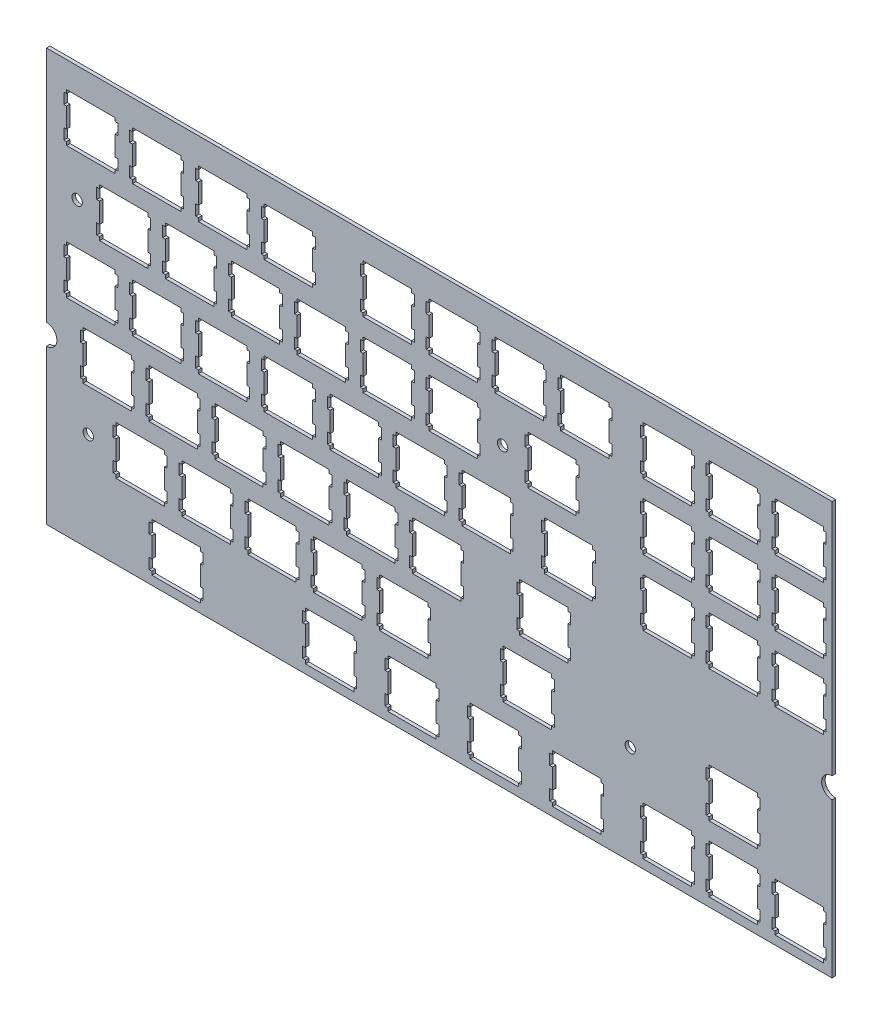
from build123d import *

# Parameters (mm, degrees)
MODEL_R         = 1.5
EXTRUDE_1_DEPTH = 1


with BuildPart() as part:
    # Model → 凸台-拉伸1 (new body)
    with BuildSketch(Plane.XY):
        with BuildLine():
            Line((423.20103802, 126.210093993), (423.20103802, 194.884693993))
            Line((423.20103802, 194.884693993), (196.08703802, 194.884693993))
            Line((196.08703802, 194.884693993), (196.08703802, 126.210093993))
            ThreePointArc((196.08703802, 126.210093993), (199.08703802, 123.210093993), (196.08703802, 120.210093993))
            Line((196.08703802, 120.210093993), (196.08703802, 75.584386993))
            Line((196.08703802, 75.584386993), (423.20103802, 75.584386993))
            Line((423.20103802, 75.584386993), (423.20103802, 120.210093993))
            ThreePointArc((423.20103802, 120.210093993), (420.20103802, 123.210093993), (423.20103802, 126.210093993))
        make_face()
        Polygon((226.56101302, 82.210013993), (226.56101302, 88.011523993), (225.76181302, 88.011523993), (225.76181302, 91.110823993), (226.56101302, 91.110823993), (226.56101302, 92.111223993), (240.56181302, 92.111223993), (240.56181302, 91.110823993), (241.36121302, 91.110823993), (241.36121302, 88.011523993), (240.56181302, 88.011523993), (240.56181302, 82.210013993), (241.36121302, 82.210013993), (241.36121302, 79.110833993), (240.56181302, 79.110833993), (240.56181302, 78.110363993), (226.56101302, 78.110363993), (226.56101302, 79.110833993), (225.76181302, 79.110833993), (225.76181302, 82.210013993), align=None, mode=Mode.SUBTRACT)
        with Locations((208.17503802, 104.160393993)):
            Circle(MODEL_R, mode=Mode.SUBTRACT)
        Polygon((216.17503802, 110.159393993), (216.17503802, 111.159693993), (223.17503802, 111.159693993), (230.17503802, 111.159693993), (230.17503802, 110.159393993), (230.97403802, 110.159393993), (230.97403802, 107.061493993), (230.17503802, 107.061493993), (230.17503802, 101.259993993), (230.97403802, 101.259993993), (230.97403802, 98.159393993), (230.17503802, 98.159393993), (230.17503802, 97.160293993), (216.17503802, 97.160293993), (216.17503802, 98.159393993), (215.37403802, 98.159393993), (215.37403802, 101.259993993), (216.17503802, 101.259993993), (216.17503802, 107.061493993), (215.37403802, 107.061493993), (215.37403802, 110.159393993), align=None, mode=Mode.SUBTRACT)
        Polygon((235.22503802, 110.159393993), (235.22503802, 111.159693993), (242.22503802, 111.159693993), (249.22503802, 111.159693993), (249.22503802, 110.159393993), (250.02403802, 110.159393993), (250.02403802, 107.061493993), (249.22503802, 107.061493993), (249.22503802, 101.259993993), (250.02403802, 101.259993993), (250.02403802, 98.159393993), (249.22503802, 98.159393993), (249.22503802, 97.160293993), (235.22503802, 97.160293993), (235.22503802, 98.159393993), (234.42403802, 98.159393993), (234.42403802, 101.259993993), (235.22503802, 101.259993993), (235.22503802, 107.061493993), (234.42403802, 107.061493993), (234.42403802, 110.159393993), align=None, mode=Mode.SUBTRACT)
        Polygon((270.94403802, 91.110793993), (270.94403802, 92.111193993), (277.94353802, 92.111193993), (284.94303802, 92.111193993), (284.94303802, 91.110793993), (285.74403802, 91.110793993), (285.74403802, 88.011493993), (284.94303802, 88.011493993), (284.94303802, 85.111493993), (284.94303802, 82.209983993), (285.74403802, 82.209983993), (285.74403802, 79.110803993), (284.94303802, 79.110803993), (284.94303802, 78.110333993), (270.94403802, 78.110333993), (270.94403802, 79.110803993), (270.14303802, 79.110803993), (270.14303802, 82.209983993), (270.94403802, 82.209983993), (270.94403802, 85.111493993), (270.94403802, 88.011493993), (270.14303802, 88.011493993), (270.14303802, 91.110793993), align=None, mode=Mode.SUBTRACT)
        Polygon((294.75503802, 91.110793993), (294.75503802, 92.111193993), (301.75553802, 92.111193993), (308.75603802, 92.111193993), (308.75603802, 91.110793993), (309.55503802, 91.110793993), (309.55503802, 88.011493993), (308.75603802, 88.011493993), (308.75603802, 82.209983993), (309.55503802, 82.209983993), (309.55503802, 79.110803993), (308.75603802, 79.110803993), (308.75603802, 78.110333993), (294.75503802, 78.110333993), (294.75503802, 79.110803993), (293.95603802, 79.110803993), (293.95603802, 82.209983993), (294.75503802, 82.209983993), (294.75503802, 88.011493993), (293.95603802, 88.011493993), (293.95603802, 91.110793993), align=None, mode=Mode.SUBTRACT)
        Polygon((254.27503802, 110.159393993), (254.27503802, 111.159693993), (261.27503802, 111.159693993), (268.27503802, 111.159693993), (268.27503802, 110.159393993), (269.07403802, 110.159393993), (269.07403802, 107.061493993), (268.27503802, 107.061493993), (268.27503802, 101.259993993), (269.07403802, 101.259993993), (269.07403802, 98.159393993), (268.27503802, 98.159393993), (268.27503802, 97.160293993), (254.27503802, 97.160293993), (254.27503802, 98.159393993), (253.47403802, 98.159393993), (253.47403802, 101.259993993), (254.27503802, 101.259993993), (254.27503802, 107.061493993), (253.47403802, 107.061493993), (253.47403802, 110.159393993), align=None, mode=Mode.SUBTRACT)
        Polygon((273.32503802, 110.159393993), (273.32503802, 111.159693993), (280.32503802, 111.159693993), (287.32503802, 111.159693993), (287.32503802, 110.159393993), (288.12403802, 110.159393993), (288.12403802, 107.061493993), (287.32503802, 107.061493993), (287.32503802, 101.259993993), (288.12403802, 101.259993993), (288.12403802, 98.159393993), (287.32503802, 98.159393993), (287.32503802, 97.160293993), (273.32503802, 97.160293993), (273.32503802, 98.159393993), (272.52403802, 98.159393993), (272.52403802, 101.259993993), (273.32503802, 101.259993993), (273.32503802, 107.061493993), (272.52403802, 107.061493993), (272.52403802, 110.159393993), align=None, mode=Mode.SUBTRACT)
        Polygon((292.37503802, 110.159393993), (292.37503802, 111.159693993), (299.37503802, 111.159693993), (306.37503802, 111.159693993), (306.37503802, 110.159393993), (307.17403802, 110.159393993), (307.17403802, 107.061493993), (306.37503802, 107.061493993), (306.37503802, 101.259993993), (307.17403802, 101.259993993), (307.17403802, 98.159393993), (306.37503802, 98.159393993), (306.37503802, 97.160293993), (292.37503802, 97.160293993), (292.37503802, 98.159393993), (291.57403802, 98.159393993), (291.57403802, 101.259993993), (292.37503802, 101.259993993), (292.37503802, 107.061493993), (291.57403802, 107.061493993), (291.57403802, 110.159393993), align=None, mode=Mode.SUBTRACT)
        Polygon((206.65003802, 129.209293993), (206.65003802, 130.209793993), (213.65003802, 130.209793993), (220.65003802, 130.209793993), (220.65003802, 129.209293993), (221.44903802, 129.209293993), (221.44903802, 126.111493993), (220.65003802, 126.111493993), (220.65003802, 120.310093993), (221.44903802, 120.310093993), (221.44903802, 117.209493993), (220.65003802, 117.209493993), (220.65003802, 116.210493993), (206.65003802, 116.210493993), (206.65003802, 117.209493993), (205.84903802, 117.209493993), (205.84903802, 120.310093993), (206.65003802, 120.310093993), (206.65003802, 126.111493993), (205.84903802, 126.111493993), (205.84903802, 129.209293993), align=None, mode=Mode.SUBTRACT)
        Polygon((225.70003802, 129.209293993), (225.70003802, 130.209793993), (232.70003802, 130.209793993), (239.70003802, 130.209793993), (239.70003802, 129.209293993), (240.49903802, 129.209293993), (240.49903802, 126.111493993), (239.70003802, 126.111493993), (239.70003802, 120.310093993), (240.49903802, 120.310093993), (240.49903802, 117.209493993), (239.70003802, 117.209493993), (239.70003802, 116.210493993), (225.70003802, 116.210493993), (225.70003802, 117.209493993), (224.89903802, 117.209493993), (224.89903802, 120.310093993), (225.70003802, 120.310093993), (225.70003802, 126.111493993), (224.89903802, 126.111493993), (224.89903802, 129.209293993), align=None, mode=Mode.SUBTRACT)
        Polygon((244.75003802, 129.209293993), (244.75003802, 130.209793993), (251.75003802, 130.209793993), (258.75003802, 130.209793993), (258.75003802, 129.209293993), (259.54903802, 129.209293993), (259.54903802, 126.111493993), (258.75003802, 126.111493993), (258.75003802, 120.310093993), (259.54903802, 120.310093993), (259.54903802, 117.209493993), (258.75003802, 117.209493993), (258.75003802, 116.210493993), (244.75003802, 116.210493993), (244.75003802, 117.209493993), (243.94903802, 117.209493993), (243.94903802, 120.310093993), (244.75003802, 120.310093993), (244.75003802, 126.111493993), (243.94903802, 126.111493993), (243.94903802, 129.209293993), align=None, mode=Mode.SUBTRACT)
        Polygon((263.80003802, 129.209293993), (263.80003802, 130.209793993), (270.80003802, 130.209793993), (277.80003802, 130.209793993), (277.80003802, 129.209293993), (278.59903802, 129.209293993), (278.59903802, 126.111493993), (277.80003802, 126.111493993), (277.80003802, 120.310093993), (278.59903802, 120.310093993), (278.59903802, 117.209493993), (277.80003802, 117.209493993), (277.80003802, 116.210493993), (263.80003802, 116.210493993), (263.80003802, 117.209493993), (262.99903802, 117.209493993), (262.99903802, 120.310093993), (263.80003802, 120.310093993), (263.80003802, 126.111493993), (262.99903802, 126.111493993), (262.99903802, 129.209293993), align=None, mode=Mode.SUBTRACT)
        Polygon((282.85003802, 129.209293993), (282.85003802, 130.209793993), (289.85003802, 130.209793993), (296.85003802, 130.209793993), (296.85003802, 129.209293993), (297.64903802, 129.209293993), (297.64903802, 126.111493993), (296.85003802, 126.111493993), (296.85003802, 120.310093993), (297.64903802, 120.310093993), (297.64903802, 117.209493993), (296.85003802, 117.209493993), (296.85003802, 116.210493993), (282.85003802, 116.210493993), (282.85003802, 117.209493993), (282.04903802, 117.209493993), (282.04903802, 120.310093993), (282.85003802, 120.310093993), (282.85003802, 126.111493993), (282.04903802, 126.111493993), (282.04903802, 129.209293993), align=None, mode=Mode.SUBTRACT)
        Polygon((318.56903802, 91.110793993), (318.56903802, 92.111193993), (325.56853802, 92.111193993), (332.56803802, 92.111193993), (332.56803802, 91.110793993), (333.36903802, 91.110793993), (333.36903802, 88.011493993), (332.56803802, 88.011493993), (332.56803802, 85.111493993), (332.56803802, 82.209983993), (333.36903802, 82.209983993), (333.36903802, 79.110803993), (332.56803802, 79.110803993), (332.56803802, 78.110333993), (318.56903802, 78.110333993), (318.56903802, 79.110803993), (317.76803802, 79.110803993), (317.76803802, 82.209983993), (318.56903802, 82.209983993), (318.56903802, 85.111493993), (318.56903802, 88.011493993), (317.76803802, 88.011493993), (317.76803802, 91.110793993), align=None, mode=Mode.SUBTRACT)
        Polygon((342.38003802, 91.110793993), (342.38003802, 92.111193993), (349.38053802, 92.111193993), (356.38103802, 92.111193993), (356.38103802, 91.110793993), (357.18003802, 91.110793993), (357.18003802, 88.011493993), (356.38103802, 88.011493993), (356.38103802, 82.209983993), (357.18003802, 82.209983993), (357.18003802, 79.110803993), (356.38103802, 79.110803993), (356.38103802, 78.110333993), (342.38003802, 78.110333993), (342.38003802, 79.110803993), (341.58103802, 79.110803993), (341.58103802, 82.209983993), (342.38003802, 82.209983993), (342.38003802, 88.011493993), (341.58103802, 88.011493993), (341.58103802, 91.110793993), align=None, mode=Mode.SUBTRACT)
        Polygon((328.09201302, 110.160048993), (328.09201302, 111.160448993), (342.09281302, 111.160448993), (342.09281302, 110.160048993), (342.89221302, 110.160048993), (342.89221302, 107.060748993), (342.09281302, 107.060748993), (342.09281302, 101.259238993), (342.89221302, 101.259238993), (342.89221302, 98.160058993), (342.09281302, 98.160058993), (342.09281302, 97.159588993), (328.09201302, 97.159588993), (328.09201302, 98.160058993), (327.29281302, 98.160058993), (327.29281302, 101.259238993), (328.09201302, 101.259238993), (328.09201302, 107.060748993), (327.29281302, 107.060748993), (327.29281302, 110.160048993), align=None, mode=Mode.SUBTRACT)
        with Locations((364.85892552, 104.160368993)):
            Circle(MODEL_R, mode=Mode.SUBTRACT)
        Polygon((368.57503802, 91.110793993), (368.57503802, 92.111193993), (375.57503802, 92.111193993), (382.57503802, 92.111193993), (382.57503802, 91.110793993), (383.37403802, 91.110793993), (383.37403802, 88.011493993), (382.57503802, 88.011493993), (382.57503802, 82.209983993), (383.37403802, 82.209983993), (383.37403802, 79.110803993), (382.57503802, 79.110803993), (382.57503802, 78.110333993), (368.57503802, 78.110333993), (368.57503802, 79.110803993), (367.77403802, 79.110803993), (367.77403802, 82.209983993), (368.57503802, 82.209983993), (368.57503802, 88.011493993), (367.77403802, 88.011493993), (367.77403802, 91.110793993), align=None, mode=Mode.SUBTRACT)
        Polygon((387.62503802, 91.110793993), (387.62503802, 92.111193993), (394.62503802, 92.111193993), (401.62503802, 92.111193993), (401.62503802, 91.110793993), (402.42403802, 91.110793993), (402.42403802, 88.011493993), (401.62503802, 88.011493993), (401.62503802, 82.209983993), (402.42403802, 82.209983993), (402.42403802, 79.110803993), (401.62503802, 79.110803993), (401.62503802, 78.110333993), (387.62503802, 78.110333993), (387.62503802, 79.110803993), (386.82403802, 79.110803993), (386.82403802, 82.209983993), (387.62503802, 82.209983993), (387.62503802, 88.011493993), (386.82403802, 88.011493993), (386.82403802, 91.110793993), align=None, mode=Mode.SUBTRACT)
        Polygon((406.67503802, 91.110793993), (406.67503802, 92.111193993), (413.67503802, 92.111193993), (420.67503802, 92.111193993), (420.67503802, 91.110793993), (421.47403802, 91.110793993), (421.47403802, 88.011493993), (420.67503802, 88.011493993), (420.67503802, 82.209983993), (421.47403802, 82.209983993), (421.47403802, 79.110803993), (420.67503802, 79.110803993), (420.67503802, 78.110333993), (406.67503802, 78.110333993), (406.67503802, 79.110803993), (405.87403802, 79.110803993), (405.87403802, 82.209983993), (406.67503802, 82.209983993), (406.67503802, 88.011493993), (405.87403802, 88.011493993), (405.87403802, 91.110793993), align=None, mode=Mode.SUBTRACT)
        Polygon((387.62503802, 110.159393993), (387.62503802, 111.159693993), (394.62503802, 111.159693993), (401.62503802, 111.159693993), (401.62503802, 110.159393993), (402.42403802, 110.159393993), (402.42403802, 107.061493993), (401.62503802, 107.061493993), (401.62503802, 101.259993993), (402.42403802, 101.259993993), (402.42403802, 98.159393993), (401.62503802, 98.159393993), (401.62503802, 97.160293993), (387.62503802, 97.160293993), (387.62503802, 98.159393993), (386.82403802, 98.159393993), (386.82403802, 101.259993993), (387.62503802, 101.259993993), (387.62503802, 107.061493993), (386.82403802, 107.061493993), (386.82403802, 110.159393993), align=None, mode=Mode.SUBTRACT)
        Polygon((301.90003802, 129.209293993), (301.90003802, 130.209793993), (308.90003802, 130.209793993), (315.90003802, 130.209793993), (315.90003802, 129.209293993), (316.69903802, 129.209293993), (316.69903802, 126.111493993), (315.90003802, 126.111493993), (315.90003802, 120.310093993), (316.69903802, 120.310093993), (316.69903802, 117.209493993), (315.90003802, 117.209493993), (315.90003802, 116.210493993), (301.90003802, 116.210493993), (301.90003802, 117.209493993), (301.09903802, 117.209493993), (301.09903802, 120.310093993), (301.90003802, 120.310093993), (301.90003802, 126.111493993), (301.09903802, 126.111493993), (301.09903802, 129.209293993), align=None, mode=Mode.SUBTRACT)
        Polygon((332.85503802, 129.209293993), (332.85503802, 130.209793993), (339.85553802, 130.209793993), (346.85603802, 130.209793993), (346.85603802, 129.209293993), (347.65503802, 129.209293993), (347.65503802, 126.111493993), (346.85603802, 126.111493993), (346.85603802, 120.310093993), (347.65503802, 120.310093993), (347.65503802, 117.209493993), (346.85603802, 117.209493993), (346.85603802, 116.210493993), (332.85503802, 116.210493993), (332.85503802, 117.209493993), (332.05403802, 117.209493993), (332.05403802, 120.310093993), (332.85503802, 120.310093993), (332.85503802, 126.111493993), (332.05403802, 126.111493993), (332.05403802, 129.209293993), align=None, mode=Mode.SUBTRACT)
        Polygon((215.88703802, 135.260493993), (201.88803802, 135.260493993), (201.88803802, 136.259493993), (201.08703802, 136.259493993), (201.08703802, 139.360093993), (201.88803802, 139.360093993), (201.88803802, 142.260093993), (201.88803802, 145.160093993), (201.08703802, 145.160093993), (201.08703802, 148.259293993), (201.88803802, 148.259293993), (201.88803802, 149.259793993), (208.88753802, 149.259793993), (215.88703802, 149.259793993), (215.88703802, 148.259293993), (216.68803802, 148.259293993), (216.68803802, 145.160093993), (215.88703802, 145.160093993), (215.88703802, 142.260093993), (215.88703802, 139.360093993), (216.68803802, 139.360093993), (216.68803802, 136.259493993), (215.88703802, 136.259493993), align=None, mode=Mode.SUBTRACT)
        Polygon((220.93803802, 148.259293993), (220.93803802, 149.259793993), (227.93753802, 149.259793993), (234.93703802, 149.259793993), (234.93703802, 148.259293993), (235.73803802, 148.259293993), (235.73803802, 145.160093993), (234.93703802, 145.160093993), (234.93703802, 142.260093993), (234.93703802, 139.360093993), (235.73803802, 139.360093993), (235.73803802, 136.259493993), (234.93703802, 136.259493993), (234.93703802, 135.260493993), (220.93803802, 135.260493993), (220.93803802, 136.259493993), (220.13703802, 136.259493993), (220.13703802, 139.360093993), (220.93803802, 139.360093993), (220.93803802, 142.260093993), (220.93803802, 145.160093993), (220.13703802, 145.160093993), (220.13703802, 148.259293993), align=None, mode=Mode.SUBTRACT)
        Polygon((239.98803802, 148.259293993), (239.98803802, 149.259793993), (246.98753802, 149.259793993), (253.98703802, 149.259793993), (253.98703802, 148.259293993), (254.78803802, 148.259293993), (254.78803802, 145.160093993), (253.98703802, 145.160093993), (253.98703802, 142.260093993), (253.98703802, 139.360093993), (254.78803802, 139.360093993), (254.78803802, 136.259493993), (253.98703802, 136.259493993), (253.98703802, 135.260493993), (239.98803802, 135.260493993), (239.98803802, 136.259493993), (239.18703802, 136.259493993), (239.18703802, 139.360093993), (239.98803802, 139.360093993), (239.98803802, 142.260093993), (239.98803802, 145.160093993), (239.18703802, 145.160093993), (239.18703802, 148.259293993), align=None, mode=Mode.SUBTRACT)
        with Locations((204.94992552, 161.310093993)):
            Circle(MODEL_R, mode=Mode.SUBTRACT)
        Polygon((211.41303802, 167.309293993), (211.41303802, 168.309793993), (218.41253802, 168.309793993), (225.41203802, 168.309793993), (225.41203802, 167.309293993), (226.21303802, 167.309293993), (226.21303802, 164.210093993), (225.41203802, 164.210093993), (225.41203802, 161.310093993), (225.41203802, 158.410093993), (226.21303802, 158.410093993), (226.21303802, 155.309493993), (225.41203802, 155.309493993), (225.41203802, 154.310493993), (211.41303802, 154.310493993), (211.41303802, 155.309493993), (210.61203802, 155.309493993), (210.61203802, 158.410093993), (211.41303802, 158.410093993), (211.41303802, 161.310093993), (211.41303802, 164.210093993), (210.61203802, 164.210093993), (210.61203802, 167.309293993), align=None, mode=Mode.SUBTRACT)
        Polygon((230.46303802, 167.309293993), (230.46303802, 168.309793993), (237.46253802, 168.309793993), (244.46203802, 168.309793993), (244.46203802, 167.309293993), (245.26303802, 167.309293993), (245.26303802, 164.210093993), (244.46203802, 164.210093993), (244.46203802, 161.310093993), (244.46203802, 158.410093993), (245.26303802, 158.410093993), (245.26303802, 155.309493993), (244.46203802, 155.309493993), (244.46203802, 154.310493993), (230.46303802, 154.310493993), (230.46303802, 155.309493993), (229.66203802, 155.309493993), (229.66203802, 158.410093993), (230.46303802, 158.410093993), (230.46303802, 161.310093993), (230.46303802, 164.210093993), (229.66203802, 164.210093993), (229.66203802, 167.309293993), align=None, mode=Mode.SUBTRACT)
        Polygon((259.03803802, 148.259293993), (259.03803802, 149.259793993), (266.03753802, 149.259793993), (273.03703802, 149.259793993), (273.03703802, 148.259293993), (273.83803802, 148.259293993), (273.83803802, 145.160093993), (273.03703802, 145.160093993), (273.03703802, 142.260093993), (273.03703802, 139.360093993), (273.83803802, 139.360093993), (273.83803802, 136.259493993), (273.03703802, 136.259493993), (273.03703802, 135.260493993), (259.03803802, 135.260493993), (259.03803802, 136.259493993), (258.23703802, 136.259493993), (258.23703802, 139.360093993), (259.03803802, 139.360093993), (259.03803802, 142.260093993), (259.03803802, 145.160093993), (258.23703802, 145.160093993), (258.23703802, 148.259293993), align=None, mode=Mode.SUBTRACT)
        Polygon((278.08803802, 148.259293993), (278.08803802, 149.259793993), (285.08753802, 149.259793993), (292.08703802, 149.259793993), (292.08703802, 148.259293993), (292.88803802, 148.259293993), (292.88803802, 145.160093993), (292.08703802, 145.160093993), (292.08703802, 142.260093993), (292.08703802, 139.360093993), (292.88803802, 139.360093993), (292.88803802, 136.259493993), (292.08703802, 136.259493993), (292.08703802, 135.260493993), (278.08803802, 135.260493993), (278.08803802, 136.259493993), (277.28703802, 136.259493993), (277.28703802, 139.360093993), (278.08803802, 139.360093993), (278.08803802, 142.260093993), (278.08803802, 145.160093993), (277.28703802, 145.160093993), (277.28703802, 148.259293993), align=None, mode=Mode.SUBTRACT)
        Polygon((297.13803802, 148.259293993), (297.13803802, 149.259793993), (304.13753802, 149.259793993), (311.13703802, 149.259793993), (311.13703802, 148.259293993), (311.93803802, 148.259293993), (311.93803802, 145.160093993), (311.13703802, 145.160093993), (311.13703802, 142.260093993), (311.13703802, 139.360093993), (311.93803802, 139.360093993), (311.93803802, 136.259493993), (311.13703802, 136.259493993), (311.13703802, 135.260493993), (297.13803802, 135.260493993), (297.13803802, 136.259493993), (296.33703802, 136.259493993), (296.33703802, 139.360093993), (297.13803802, 139.360093993), (297.13803802, 142.260093993), (297.13803802, 145.160093993), (296.33703802, 145.160093993), (296.33703802, 148.259293993), align=None, mode=Mode.SUBTRACT)
        Polygon((249.51303802, 167.309293993), (249.51303802, 168.309793993), (256.51253802, 168.309793993), (263.51203802, 168.309793993), (263.51203802, 167.309293993), (264.31303802, 167.309293993), (264.31303802, 164.210093993), (263.51203802, 164.210093993), (263.51203802, 161.310093993), (263.51203802, 158.410093993), (264.31303802, 158.410093993), (264.31303802, 155.309493993), (263.51203802, 155.309493993), (263.51203802, 154.310493993), (249.51303802, 154.310493993), (249.51303802, 155.309493993), (248.71203802, 155.309493993), (248.71203802, 158.410093993), (249.51303802, 158.410093993), (249.51303802, 161.310093993), (249.51303802, 164.210093993), (248.71203802, 164.210093993), (248.71203802, 167.309293993), align=None, mode=Mode.SUBTRACT)
        Polygon((268.56303802, 167.309293993), (268.56303802, 168.309793993), (275.56253802, 168.309793993), (282.56203802, 168.309793993), (282.56203802, 167.309293993), (283.36303802, 167.309293993), (283.36303802, 164.210093993), (282.56203802, 164.210093993), (282.56203802, 161.310093993), (282.56203802, 158.410093993), (283.36303802, 158.410093993), (283.36303802, 155.309493993), (282.56203802, 155.309493993), (282.56203802, 154.310493993), (268.56303802, 154.310493993), (268.56303802, 155.309493993), (267.76203802, 155.309493993), (267.76203802, 158.410093993), (268.56303802, 158.410093993), (268.56303802, 161.310093993), (268.56303802, 164.210093993), (267.76203802, 164.210093993), (267.76203802, 167.309293993), align=None, mode=Mode.SUBTRACT)
        Polygon((287.61303802, 167.309293993), (287.61303802, 168.309793993), (294.61253802, 168.309793993), (301.61203802, 168.309793993), (301.61203802, 167.309293993), (302.41303802, 167.309293993), (302.41303802, 164.210093993), (301.61203802, 164.210093993), (301.61203802, 161.310093993), (301.61203802, 158.410093993), (302.41303802, 158.410093993), (302.41303802, 155.309493993), (301.61203802, 155.309493993), (301.61203802, 154.310493993), (287.61303802, 154.310493993), (287.61303802, 155.309493993), (286.81203802, 155.309493993), (286.81203802, 158.410093993), (287.61303802, 158.410093993), (287.61303802, 161.310093993), (287.61303802, 164.210093993), (286.81203802, 164.210093993), (286.81203802, 167.309293993), align=None, mode=Mode.SUBTRACT)
        Polygon((215.88703802, 173.360493993), (201.88803802, 173.360493993), (201.88803802, 174.359493993), (201.08703802, 174.359493993), (201.08703802, 177.459693993), (201.88803802, 177.459693993), (201.88803802, 180.359993993), (201.88803802, 183.259693993), (201.08703802, 183.259693993), (201.08703802, 186.359693993), (201.88803802, 186.359693993), (201.88803802, 187.359693993), (215.88703802, 187.359693993), (215.88703802, 186.359693993), (216.68803802, 186.359693993), (216.68803802, 183.259693993), (215.88703802, 183.259693993), (215.88703802, 180.359993993), (215.88703802, 177.459693993), (216.68803802, 177.459693993), (216.68803802, 174.359493993), (215.88703802, 174.359493993), align=None, mode=Mode.SUBTRACT)
        Polygon((220.93803802, 186.359693993), (220.93803802, 187.359693993), (227.93753802, 187.359693993), (234.93703802, 187.359693993), (234.93703802, 186.359693993), (235.73803802, 186.359693993), (235.73803802, 183.259693993), (234.93703802, 183.259693993), (234.93703802, 180.359993993), (234.93703802, 177.459693993), (235.73803802, 177.459693993), (235.73803802, 174.359493993), (234.93703802, 174.359493993), (234.93703802, 173.360493993), (220.93803802, 173.360493993), (220.93803802, 174.359493993), (220.13703802, 174.359493993), (220.13703802, 177.459693993), (220.93803802, 177.459693993), (220.93803802, 180.359993993), (220.93803802, 183.259693993), (220.13703802, 183.259693993), (220.13703802, 186.359693993), align=None, mode=Mode.SUBTRACT)
        Polygon((239.98803802, 186.359693993), (239.98803802, 187.359693993), (246.98753802, 187.359693993), (253.98703802, 187.359693993), (253.98703802, 186.359693993), (254.78803802, 186.359693993), (254.78803802, 183.259693993), (253.98703802, 183.259693993), (253.98703802, 180.359993993), (253.98703802, 177.459693993), (254.78803802, 177.459693993), (254.78803802, 174.359493993), (253.98703802, 174.359493993), (253.98703802, 173.360493993), (239.98803802, 173.360493993), (239.98803802, 174.359493993), (239.18703802, 174.359493993), (239.18703802, 177.459693993), (239.98803802, 177.459693993), (239.98803802, 180.359993993), (239.98803802, 183.259693993), (239.18703802, 183.259693993), (239.18703802, 186.359693993), align=None, mode=Mode.SUBTRACT)
        Polygon((259.03803802, 186.359693993), (259.03803802, 187.359693993), (266.03753802, 187.359693993), (273.03703802, 187.359693993), (273.03703802, 186.359693993), (273.83803802, 186.359693993), (273.83803802, 183.259693993), (273.03703802, 183.259693993), (273.03703802, 180.359993993), (273.03703802, 177.459693993), (273.83803802, 177.459693993), (273.83803802, 174.359493993), (273.03703802, 174.359493993), (273.03703802, 173.360493993), (259.03803802, 173.360493993), (259.03803802, 174.359493993), (258.23703802, 174.359493993), (258.23703802, 177.459693993), (259.03803802, 177.459693993), (259.03803802, 180.359993993), (259.03803802, 183.259693993), (258.23703802, 183.259693993), (258.23703802, 186.359693993), align=None, mode=Mode.SUBTRACT)
        Polygon((287.61303802, 186.359693993), (287.61303802, 187.359693993), (294.61253802, 187.359693993), (301.61203802, 187.359693993), (301.61203802, 186.359693993), (302.41303802, 186.359693993), (302.41303802, 183.259693993), (301.61203802, 183.259693993), (301.61203802, 180.359993993), (301.61203802, 177.459693993), (302.41303802, 177.459693993), (302.41303802, 174.359493993), (301.61203802, 174.359493993), (301.61203802, 173.360493993), (287.61303802, 173.360493993), (287.61303802, 174.359493993), (286.81203802, 174.359493993), (286.81203802, 177.459693993), (287.61303802, 177.459693993), (287.61303802, 180.359993993), (287.61303802, 183.259693993), (286.81203802, 183.259693993), (286.81203802, 186.359693993), align=None, mode=Mode.SUBTRACT)
        Polygon((316.18803802, 148.259293993), (316.18803802, 149.259793993), (323.18753802, 149.259793993), (330.18703802, 149.259793993), (330.18703802, 148.259293993), (330.98803802, 148.259293993), (330.98803802, 145.160093993), (330.18703802, 145.160093993), (330.18703802, 142.260093993), (330.18703802, 139.360093993), (330.98803802, 139.360093993), (330.98803802, 136.259493993), (330.18703802, 136.259493993), (330.18703802, 135.260493993), (316.18803802, 135.260493993), (316.18803802, 136.259493993), (315.38703802, 136.259493993), (315.38703802, 139.360093993), (316.18803802, 139.360093993), (316.18803802, 142.260093993), (316.18803802, 145.160093993), (315.38703802, 145.160093993), (315.38703802, 148.259293993), align=None, mode=Mode.SUBTRACT)
        Polygon((340.00003802, 148.259293993), (340.00003802, 149.259793993), (347.00003802, 149.259793993), (354.00003802, 149.259793993), (354.00003802, 148.259293993), (354.79903802, 148.259293993), (354.79903802, 145.160093993), (354.00003802, 145.160093993), (354.00003802, 139.360093993), (354.79903802, 139.360093993), (354.79903802, 136.259493993), (354.00003802, 136.259493993), (354.00003802, 135.260493993), (340.00003802, 135.260493993), (340.00003802, 136.259493993), (339.19903802, 136.259493993), (339.19903802, 139.360093993), (340.00003802, 139.360093993), (340.00003802, 145.160093993), (339.19903802, 145.160093993), (339.19903802, 148.259293993), align=None, mode=Mode.SUBTRACT)
        Polygon((306.66303802, 167.309293993), (306.66303802, 168.309793993), (313.66253802, 168.309793993), (320.66203802, 168.309793993), (320.66203802, 167.309293993), (321.46303802, 167.309293993), (321.46303802, 164.210093993), (320.66203802, 164.210093993), (320.66203802, 161.310093993), (320.66203802, 158.410093993), (321.46303802, 158.410093993), (321.46303802, 155.309493993), (320.66203802, 155.309493993), (320.66203802, 154.310493993), (306.66303802, 154.310493993), (306.66303802, 155.309493993), (305.86203802, 155.309493993), (305.86203802, 158.410093993), (306.66303802, 158.410093993), (306.66303802, 161.310093993), (306.66303802, 164.210093993), (305.86203802, 164.210093993), (305.86203802, 167.309293993), align=None, mode=Mode.SUBTRACT)
        with Locations((327.94992552, 161.310093993)):
            Circle(MODEL_R, mode=Mode.SUBTRACT)
        Polygon((335.23753802, 167.309293993), (335.23753802, 168.309793993), (342.23753802, 168.309793993), (349.23753802, 168.309793993), (349.23753802, 167.309293993), (350.03653802, 167.309293993), (350.03653802, 164.210093993), (349.23753802, 164.210093993), (349.23753802, 158.410093993), (350.03653802, 158.410093993), (350.03653802, 155.309493993), (349.23753802, 155.309493993), (349.23753802, 154.310493993), (335.23753802, 154.310493993), (335.23753802, 155.309493993), (334.43653802, 155.309493993), (334.43653802, 158.410093993), (335.23753802, 158.410093993), (335.23753802, 164.210093993), (334.43653802, 164.210093993), (334.43653802, 167.309293993), align=None, mode=Mode.SUBTRACT)
        Polygon((368.57503802, 148.259293993), (368.57503802, 149.259793993), (375.57503802, 149.259793993), (382.57503802, 149.259793993), (382.57503802, 148.259293993), (383.37403802, 148.259293993), (383.37403802, 145.160093993), (382.57503802, 145.160093993), (382.57503802, 139.360093993), (383.37403802, 139.360093993), (383.37403802, 136.259493993), (382.57503802, 136.259493993), (382.57503802, 135.260493993), (368.57503802, 135.260493993), (368.57503802, 136.259493993), (367.77403802, 136.259493993), (367.77403802, 139.360093993), (368.57503802, 139.360093993), (368.57503802, 145.160093993), (367.77403802, 145.160093993), (367.77403802, 148.259293993), align=None, mode=Mode.SUBTRACT)
        Polygon((387.62503802, 148.259293993), (387.62503802, 149.259793993), (394.62503802, 149.259793993), (401.62503802, 149.259793993), (401.62503802, 148.259293993), (402.42403802, 148.259293993), (402.42403802, 145.160093993), (401.62503802, 145.160093993), (401.62503802, 139.360093993), (402.42403802, 139.360093993), (402.42403802, 136.259493993), (401.62503802, 136.259493993), (401.62503802, 135.260493993), (387.62503802, 135.260493993), (387.62503802, 136.259493993), (386.82403802, 136.259493993), (386.82403802, 139.360093993), (387.62503802, 139.360093993), (387.62503802, 145.160093993), (386.82403802, 145.160093993), (386.82403802, 148.259293993), align=None, mode=Mode.SUBTRACT)
        Polygon((406.67503802, 148.259293993), (406.67503802, 149.259793993), (413.67503802, 149.259793993), (420.67503802, 149.259793993), (420.67503802, 148.259293993), (421.47403802, 148.259293993), (421.47403802, 145.160093993), (420.67503802, 145.160093993), (420.67503802, 139.360093993), (421.47403802, 139.360093993), (421.47403802, 136.259493993), (420.67503802, 136.259493993), (420.67503802, 135.260493993), (406.67503802, 135.260493993), (406.67503802, 136.259493993), (405.87403802, 136.259493993), (405.87403802, 139.360093993), (406.67503802, 139.360093993), (406.67503802, 145.160093993), (405.87403802, 145.160093993), (405.87403802, 148.259293993), align=None, mode=Mode.SUBTRACT)
        Polygon((368.57503802, 167.309293993), (368.57503802, 168.309793993), (375.57503802, 168.309793993), (382.57503802, 168.309793993), (382.57503802, 167.309293993), (383.37403802, 167.309293993), (383.37403802, 164.210093993), (382.57503802, 164.210093993), (382.57503802, 158.410093993), (383.37403802, 158.410093993), (383.37403802, 155.309493993), (382.57503802, 155.309493993), (382.57503802, 154.310493993), (368.57503802, 154.310493993), (368.57503802, 155.309493993), (367.77403802, 155.309493993), (367.77403802, 158.410093993), (368.57503802, 158.410093993), (368.57503802, 164.210093993), (367.77403802, 164.210093993), (367.77403802, 167.309293993), align=None, mode=Mode.SUBTRACT)
        Polygon((387.62503802, 167.309293993), (387.62503802, 168.309793993), (394.62503802, 168.309793993), (401.62503802, 168.309793993), (401.62503802, 167.309293993), (402.42403802, 167.309293993), (402.42403802, 164.210093993), (401.62503802, 164.210093993), (401.62503802, 158.410093993), (402.42403802, 158.410093993), (402.42403802, 155.309493993), (401.62503802, 155.309493993), (401.62503802, 154.310493993), (387.62503802, 154.310493993), (387.62503802, 155.309493993), (386.82403802, 155.309493993), (386.82403802, 158.410093993), (387.62503802, 158.410093993), (387.62503802, 164.210093993), (386.82403802, 164.210093993), (386.82403802, 167.309293993), align=None, mode=Mode.SUBTRACT)
        Polygon((406.67503802, 167.309293993), (406.67503802, 168.309793993), (413.67503802, 168.309793993), (420.67503802, 168.309793993), (420.67503802, 167.309293993), (421.47403802, 167.309293993), (421.47403802, 164.210093993), (420.67503802, 164.210093993), (420.67503802, 158.410093993), (421.47403802, 158.410093993), (421.47403802, 155.309493993), (420.67503802, 155.309493993), (420.67503802, 154.310493993), (406.67503802, 154.310493993), (406.67503802, 155.309493993), (405.87403802, 155.309493993), (405.87403802, 158.410093993), (406.67503802, 158.410093993), (406.67503802, 164.210093993), (405.87403802, 164.210093993), (405.87403802, 167.309293993), align=None, mode=Mode.SUBTRACT)
        Polygon((306.66303802, 186.359693993), (306.66303802, 187.359693993), (313.66253802, 187.359693993), (320.66203802, 187.359693993), (320.66203802, 186.359693993), (321.46303802, 186.359693993), (321.46303802, 183.259693993), (320.66203802, 183.259693993), (320.66203802, 180.359993993), (320.66203802, 177.459693993), (321.46303802, 177.459693993), (321.46303802, 174.359493993), (320.66203802, 174.359493993), (320.66203802, 173.360493993), (306.66303802, 173.360493993), (306.66303802, 174.359493993), (305.86203802, 174.359493993), (305.86203802, 177.459693993), (306.66303802, 177.459693993), (306.66303802, 180.359993993), (306.66303802, 183.259693993), (305.86203802, 183.259693993), (305.86203802, 186.359693993), align=None, mode=Mode.SUBTRACT)
        Polygon((325.71303802, 186.359693993), (325.71303802, 187.359693993), (332.71253802, 187.359693993), (339.71203802, 187.359693993), (339.71203802, 186.359693993), (340.51303802, 186.359693993), (340.51303802, 183.259693993), (339.71203802, 183.259693993), (339.71203802, 180.359993993), (339.71203802, 177.459693993), (340.51303802, 177.459693993), (340.51303802, 174.359493993), (339.71203802, 174.359493993), (339.71203802, 173.360493993), (325.71303802, 173.360493993), (325.71303802, 174.359493993), (324.91203802, 174.359493993), (324.91203802, 177.459693993), (325.71303802, 177.459693993), (325.71303802, 180.359993993), (325.71303802, 183.259693993), (324.91203802, 183.259693993), (324.91203802, 186.359693993), align=None, mode=Mode.SUBTRACT)
        Polygon((344.76303802, 186.359693993), (344.76303802, 187.359693993), (351.76253802, 187.359693993), (358.76203802, 187.359693993), (358.76203802, 186.359693993), (359.56303802, 186.359693993), (359.56303802, 183.259693993), (358.76203802, 183.259693993), (358.76203802, 180.359993993), (358.76203802, 177.459693993), (359.56303802, 177.459693993), (359.56303802, 174.359493993), (358.76203802, 174.359493993), (358.76203802, 173.360493993), (344.76303802, 173.360493993), (344.76303802, 174.359493993), (343.96203802, 174.359493993), (343.96203802, 177.459693993), (344.76303802, 177.459693993), (344.76303802, 180.359993993), (344.76303802, 183.259693993), (343.96203802, 183.259693993), (343.96203802, 186.359693993), align=None, mode=Mode.SUBTRACT)
        Polygon((368.57503802, 186.359693993), (368.57503802, 187.359693993), (375.57503802, 187.359693993), (382.57503802, 187.359693993), (382.57503802, 186.359693993), (383.37403802, 186.359693993), (383.37403802, 183.259693993), (382.57503802, 183.259693993), (382.57503802, 177.459693993), (383.37403802, 177.459693993), (383.37403802, 174.359493993), (382.57503802, 174.359493993), (382.57503802, 173.360493993), (368.57503802, 173.360493993), (368.57503802, 174.359493993), (367.77403802, 174.359493993), (367.77403802, 177.459693993), (368.57503802, 177.459693993), (368.57503802, 183.259693993), (367.77403802, 183.259693993), (367.77403802, 186.359693993), align=None, mode=Mode.SUBTRACT)
        Polygon((387.62503802, 186.359693993), (387.62503802, 187.359693993), (394.62503802, 187.359693993), (401.62503802, 187.359693993), (401.62503802, 186.359693993), (402.42403802, 186.359693993), (402.42403802, 183.259693993), (401.62503802, 183.259693993), (401.62503802, 177.459693993), (402.42403802, 177.459693993), (402.42403802, 174.359493993), (401.62503802, 174.359493993), (401.62503802, 173.360493993), (387.62503802, 173.360493993), (387.62503802, 174.359493993), (386.82403802, 174.359493993), (386.82403802, 177.459693993), (387.62503802, 177.459693993), (387.62503802, 183.259693993), (386.82403802, 183.259693993), (386.82403802, 186.359693993), align=None, mode=Mode.SUBTRACT)
        Polygon((406.67503802, 186.359693993), (406.67503802, 187.359693993), (413.67503802, 187.359693993), (420.67503802, 187.359693993), (420.67503802, 186.359693993), (421.47403802, 186.359693993), (421.47403802, 183.259693993), (420.67503802, 183.259693993), (420.67503802, 177.459693993), (421.47403802, 177.459693993), (421.47403802, 174.359493993), (420.67503802, 174.359493993), (420.67503802, 173.360493993), (406.67503802, 173.360493993), (406.67503802, 174.359493993), (405.87403802, 174.359493993), (405.87403802, 177.459693993), (406.67503802, 177.459693993), (406.67503802, 183.259693993), (405.87403802, 183.259693993), (405.87403802, 186.359693993), align=None, mode=Mode.SUBTRACT)
    extrude(amount=EXTRUDE_1_DEPTH)


solid = part.part
